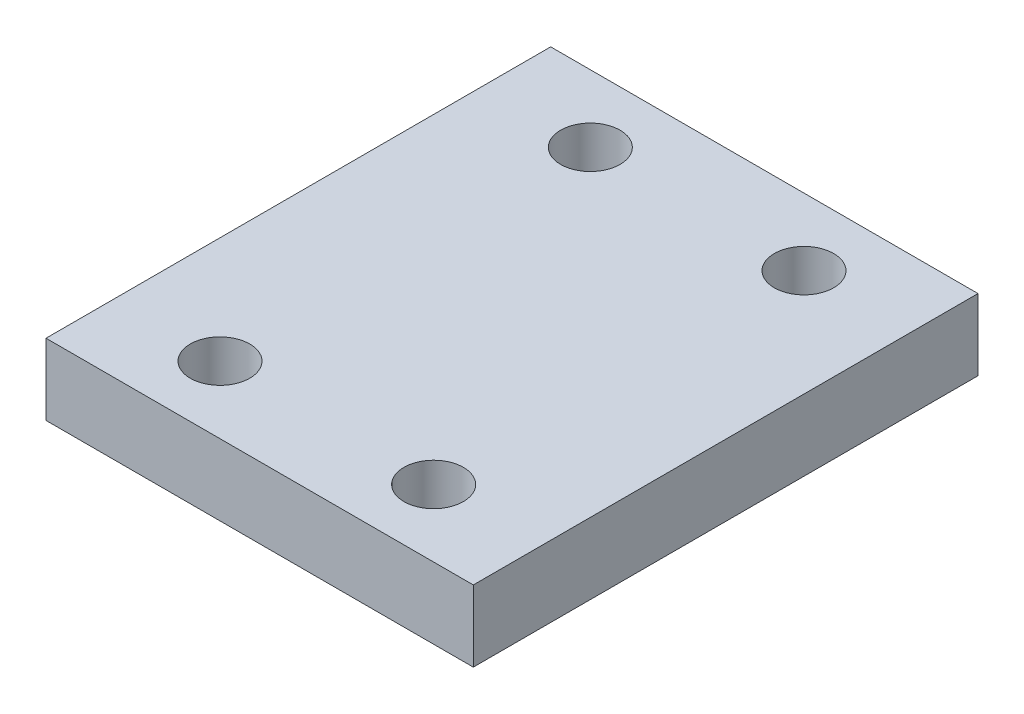
from build123d import *

# Parameters (mm, degrees)
SKETCH1_W           = 38.1
SKETCH1_H           = 45
SKETCH1_R           = 2.65
BOSS_EXTRUDE1_DEPTH = 6.35


with BuildPart() as part:
    # Sketch1 → Boss-Extrude1 (new body)
    with BuildSketch(Plane(origin=(0, 0, 0), x_dir=(1, 0, 0), z_dir=(0, 1, 0))):
        Rectangle(SKETCH1_W, SKETCH1_H)
        with Locations((-9.525, 16.51)):
            Circle(SKETCH1_R, mode=Mode.SUBTRACT)
        with Locations((9.525, 16.51)):
            Circle(SKETCH1_R, mode=Mode.SUBTRACT)
        with Locations((9.525, -16.51)):
            Circle(SKETCH1_R, mode=Mode.SUBTRACT)
        with Locations((-9.525, -16.51)):
            Circle(SKETCH1_R, mode=Mode.SUBTRACT)
    extrude(amount=BOSS_EXTRUDE1_DEPTH)


solid = part.part
